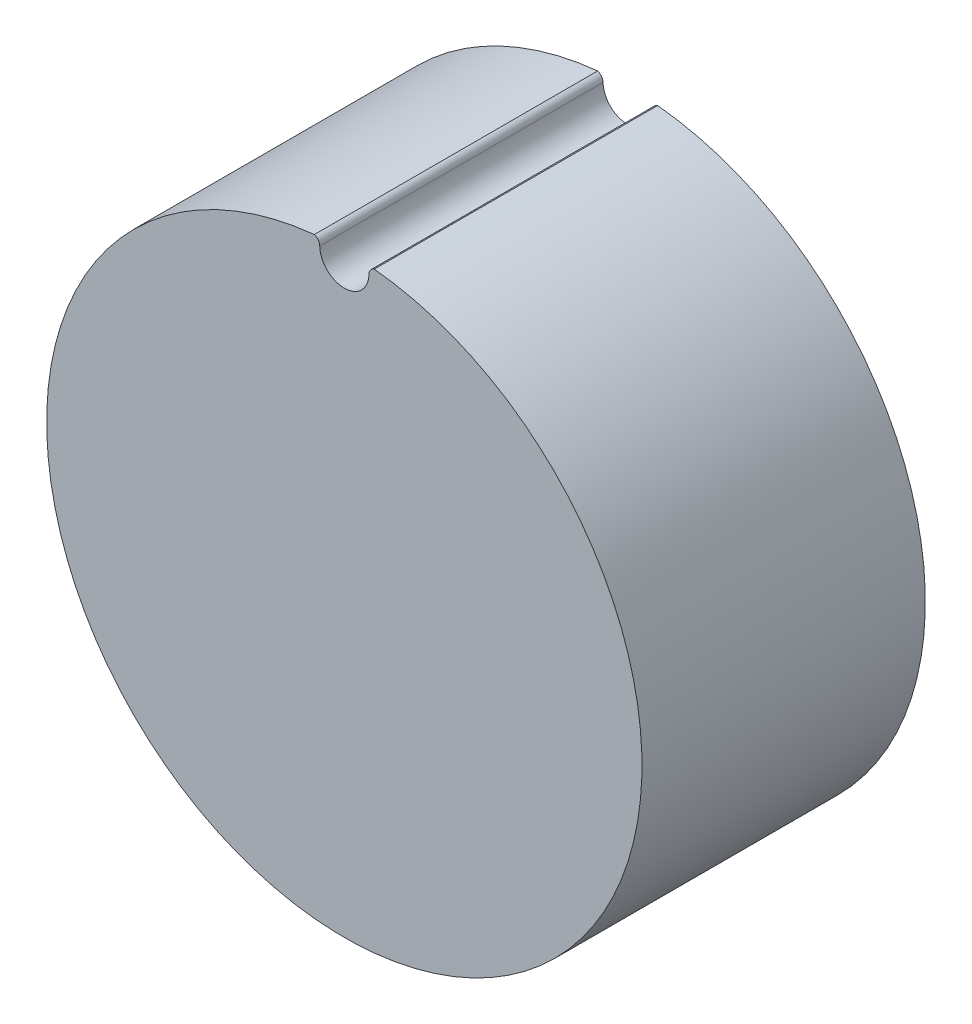
from build123d import *

# Parameters (mm, degrees)
SKETCH_1_R          = 11.555
EXTRUDE_1_DEPTH     = 11
CUT_EXTRUDE_1_REACH = 21.699


with BuildPart() as part:
    # 草圖1 → 填料-伸長1 (new body)
    with BuildSketch(Plane.XY):
        Circle(SKETCH_1_R)
    extrude(amount=EXTRUDE_1_DEPTH)

    # 草圖2 → 除料-伸長1 (cut, up to next)
    with BuildSketch(Plane.XY.offset(11), mode=Mode.PRIVATE) as cut_extrude_1_sk1:
        with BuildLine():
            ThreePointArc((1.162550039, 11.496369097), (0, 11.555), (-1.162550039, 11.496369097))
            ThreePointArc((-1.162550039, 11.496369097), (-1.013703117, 11.389263051), (-0.955, 11.215536094))
            ThreePointArc((-0.955, 11.215536094), (0, 10.275), (0.955, 11.215536094))
            ThreePointArc((0.955, 11.215536094), (1.013703117, 11.389263051), (1.162550039, 11.496369097))
        make_face()
    cut_extrude_1_tool1 = extrude(cut_extrude_1_sk1.sketch, amount=-CUT_EXTRUDE_1_REACH, mode=Mode.PRIVATE) & part.part
    add(cut_extrude_1_tool1.solids().sort_by_distance((0, 10.99734, 11))[0], mode=Mode.SUBTRACT)


solid = part.part
